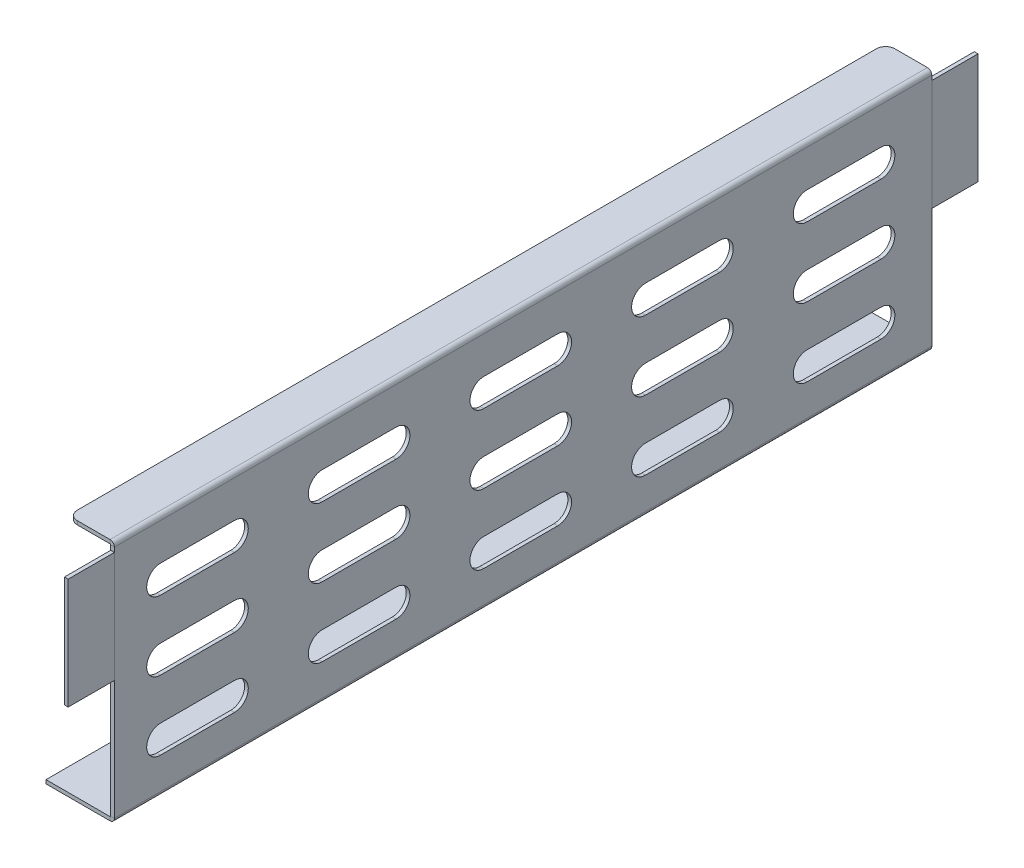
from build123d import *

# Parameters (mm, degrees)
TABAN_FLAN_1_DEPTH    = 885
KES_EKSTR_ZYON1_DEPTH = 10
L_O_ALTMA1_COUNT      = 5
L_O_ALTMA1_PITCH      = 175
L_O_ALTMA1_COUNT_DIR2 = 3
L_O_ALTMA1_PITCH_DIR2 = 75
IZIM7_W               = 4
IZIM7_H               = 120
TABAN_FLAN_2_DEPTH    = 50
IZIM10_W              = 4
IZIM10_H              = 120
TABAN_FLAN_3_DEPTH    = 50
KENAR_FLAN_1_DEPTH    = 885
RADYUS2_R             = 10


# Sheet-metal steps are written as plain solids
with BuildPart() as part:
    # Çizim1 → Taban-Flanş1 (new body)
    with BuildSketch(Plane.XY):
        with BuildLine():
            Line((0, 0), (69.2634, 0))
            ThreePointArc((69.2634, 0), (69.784254855, 0.215745145), (70, 0.7366))
            Line((70, 0.7366), (70, 250))
            Line((70, 250), (74, 250))
            Line((74, 250), (74, 0.7366))
            ThreePointArc((74, 0.7366), (72.61268198, -2.61268198), (69.2634, -4))
            Line((69.2634, -4), (0, -4))
            Line((0, -4), (0, 0))
        make_face()
    extrude(amount=TABAN_FLAN_1_DEPTH)

    # Çizim6 → Kes-Ekstrüzyon1 (cut)
    with BuildSketch(Plane(origin=(74, 0, 0), x_dir=(0, 0, -1), z_dir=(1, 0, 0))):
        with BuildLine():
            Line((-835, 215), (-755, 215))
            ThreePointArc((-755, 215), (-740, 200), (-755, 185))
            Line((-755, 185), (-835, 185))
            ThreePointArc((-835, 185), (-850, 200), (-835, 215))
        make_face()
    kes_ekstr_zyon1 = extrude(amount=-KES_EKSTR_ZYON1_DEPTH, mode=Mode.SUBTRACT)

    # LÇoğaltma1: Kes-Ekstr_zyon1 5 × 3
    with Locations(*[(0, -j * L_O_ALTMA1_PITCH_DIR2, -i * L_O_ALTMA1_PITCH) for i in range(L_O_ALTMA1_COUNT) for j in range(L_O_ALTMA1_COUNT_DIR2) if (i, j) != (0, 0)]):
        add(kes_ekstr_zyon1, mode=Mode.SUBTRACT)

    # Kenar-Flanş1 section (across the edge) → Kenar-Flanş1 (add)
    with BuildSketch(Plane(origin=(70, 255.7366, 885), x_dir=(0, -1, 0), z_dir=(0, 0, -1))):
        with BuildLine():
            Line((-4, 0.7366), (-4, 46))
            Line((-4, 46), (0, 46))
            Line((0, 46), (0, 0.7366))
            ThreePointArc((0, 0.7366), (0.215745145, 0.215745145), (0.7366, 0))
            Line((0.7366, 0), (5.7366, 0))
            Line((5.7366, 0), (5.7366, -4))
            Line((5.7366, -4), (0.7366, -4))
            ThreePointArc((0.7366, -4), (-2.61268198, -2.61268198), (-4, 0.7366))
        make_face()
    extrude(amount=KENAR_FLAN_1_DEPTH)

    # Radyus2
    radyus2_edges = [part.edges().sort_by_distance(p)[0] for p in [
        (24, 257.7366, 885),
        (24, 257.7366, 0),
    ]]
    fillet(radyus2_edges, radius=RADYUS2_R)


with BuildPart() as body_2:
    # Çizim7 → Taban-Flanş2 (new body)
    with BuildSketch(Plane.XY.offset(885)):
        with Locations((72, 190)):
            Rectangle(IZIM7_W, IZIM7_H)
    extrude(amount=TABAN_FLAN_2_DEPTH)


with BuildPart() as body_3:
    # Çizim10 → Taban-Flanş3 (new body)
    with BuildSketch(Plane(origin=(0, 0, 0), x_dir=(-1, 0, 0), z_dir=(0, 0, -1))):
        with Locations((-72, 190)):
            Rectangle(IZIM10_W, IZIM10_H)
    extrude(amount=TABAN_FLAN_3_DEPTH)


solid = Compound([part.part, body_2.part, body_3.part])
